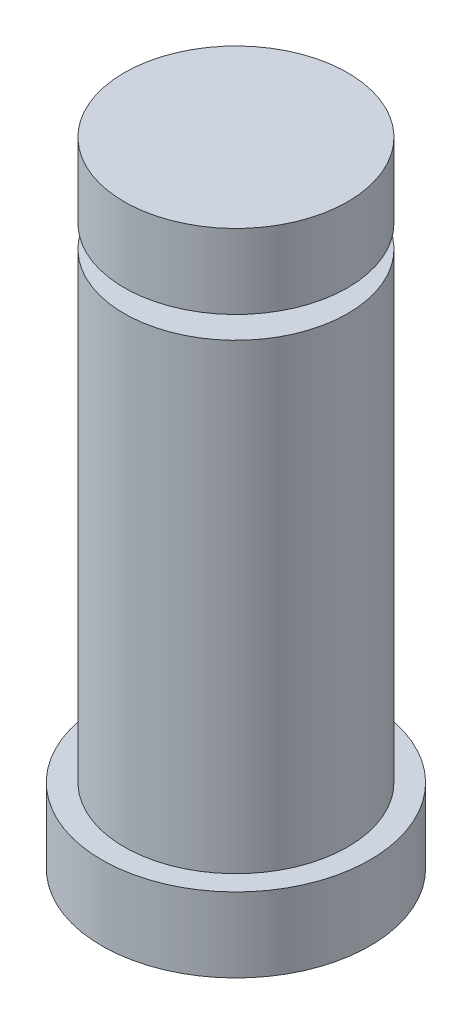
from build123d import *

# Parameters (mm, degrees)
SKETCH2_W = 2.65
SKETCH2_H = 1.5


with BuildPart() as part:
    # Sketch1 → Revolve1 (revolve)
    with BuildSketch(Plane.XY):
        Polygon((0, 0), (9, 0), (9, 5), (7.5, 5), (7.5, 42.5), (0, 42.5), align=None)
    revolve(axis=Axis((0, 47.5, 0), (0, -1, 0)))

    # Sketch2 → Cut-Revolve1 (revolve, cut)
    with BuildSketch(Plane.XY):
        with Locations((6.175, 36.75)):
            Rectangle(SKETCH2_W, SKETCH2_H)
    revolve(axis=Axis((0, 42.5, 0), (0, -1, 0)), mode=Mode.SUBTRACT)


solid = part.part
